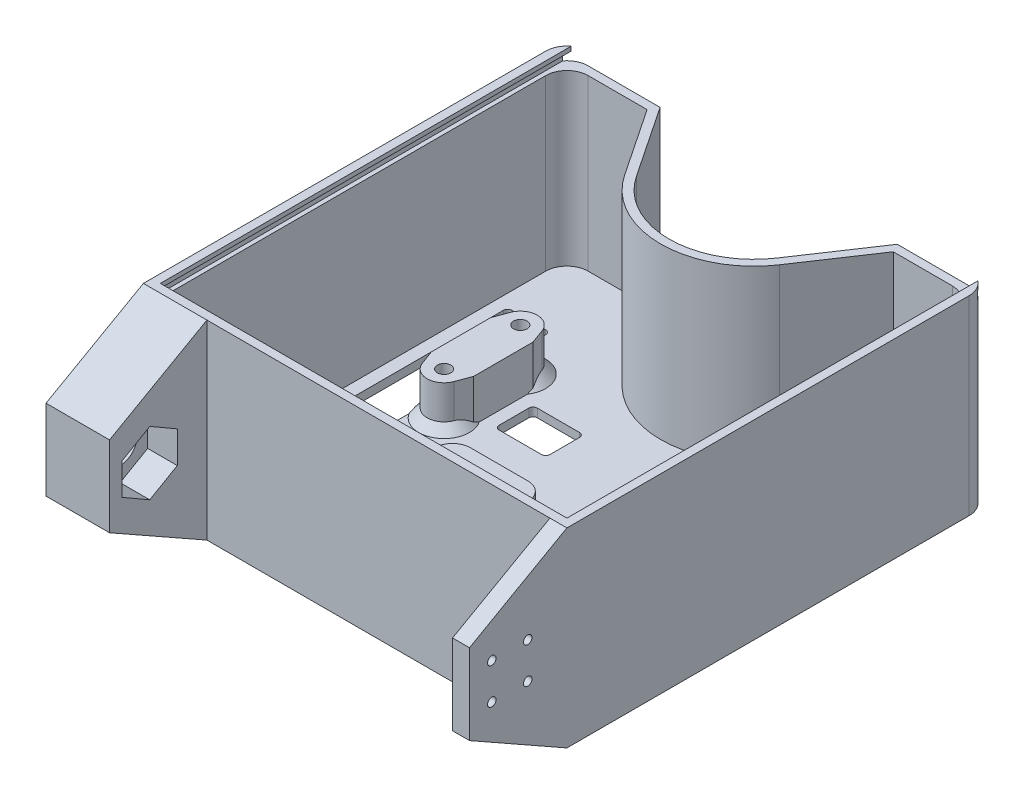
from build123d import *

# Parameters (mm, degrees)
AUFSATZ_LINEAR_AUSTRAGEN1_DEPTH  = 45
WANDUNG1_T                       = -2
SKIZZE1_W                        = 10
SKIZZE1_H                        = 42
SCHNITT_LINEAR_AUSTRAGEN1_DEPTH  = 2
SKIZZE2_R                        = 1.6
AUFSATZ_LINEAR_AUSTRAGEN2_DEPTH  = 10
VERRUNDUNG1_R                    = 1
SKIZZE6_R                        = 1.6
SCHNITT_LINEAR_AUSTRAGEN2_DEPTH  = 79.0320447
SCHNITT_LINEAR_AUSTRAGEN3_DEPTH  = 9
FASE1_SIZE                       = 2
SKIZZE8_W                        = 12
SKIZZE8_H                        = 9
SCHNITT_LINEAR_AUSTRAGEN4_DEPTH  = 2
VERRUNDUNG2_R                    = 1
VERRUNDUNG3_R                    = 5
VERRUNDUNG4_R                    = 5
SCHNITT_LINEAR_AUSTRAGEN5_REACH  = 85.815
AUFSATZ_LINEAR_AUSTRAGEN3_DEPTH  = 12
AUFSATZ_LINEAR_AUSTRAGEN4_DEPTH  = 2
FASE2_SIZE                       = 2
SKIZZE13_R                       = 1.6
SCHNITT_LINEAR_AUSTRAGEN6_DEPTH  = 2
SKIZZE14_W                       = 15
SKIZZE14_H                       = 45
SKIZZE14_W_2                     = 4
AUFSATZ_LINEAR_AUSTRAGEN5_DEPTH  = 23
SKIZZE18_R                       = 1
SCHNITT_LINEAR_AUSTRAGEN8_DEPTH  = 4
SKIZZE19_R                       = 2.5
SCHNITT_LINEAR_AUSTRAGEN9_DEPTH  = 2.5
SKIZZE20_W                       = 5
SKIZZE20_H                       = 10
SCHNITT_LINEAR_AUSTRAGEN10_DEPTH = 2
SKIZZE21_R                       = 4
SCHNITT_LINEAR_AUSTRAGEN11_DEPTH = 15
SKIZZE23_R                       = 7.5
SCHNITT_LINEAR_AUSTRAGEN12_DEPTH = 1
SKIZZE24_R                       = 7.5
SCHNITT_LINEAR_AUSTRAGEN13_DEPTH = 4
SCHNITT_LINEAR_AUSTRAGEN13_DRAFT = -45
SCHNITT_LINEAR_AUSTRAGEN14_DEPTH = 7
SCHNITT_LINEAR_AUSTRAGEN15_REACH = 133.735
SKIZZE31_W                       = 96
SKIZZE31_H                       = 3
SCHNITT_LINEAR_AUSTRAGEN16_DEPTH = 30
SKIZZE32_W                       = 98
SKIZZE32_H                       = 2
SCHNITT_LINEAR_AUSTRAGEN17_DEPTH = 99
SCHNITT_LINEAR_AUSTRAGEN18_REACH = 133.735


# Some blends are built 0.0001 mm under size
with BuildPart() as part:
    # Grundplatte → Aufsatz-Linear austragen1 (new body)
    with BuildSketch(Plane(origin=(0, 0, 0), x_dir=(1, 0, 0), z_dir=(0, 1, 0))):
        with BuildLine():
            Line((-50, 50), (-50, -50))
            Line((-50, -50), (50, -50))
            Line((50, -50), (50, 50))
            Line((50, 50), (28, 50))
            Line((28, 50), (16.61985221, 33))
            ThreePointArc((16.61985221, 33), (0, 24.125669082), (-16.61985221, 33))
            Line((-16.61985221, 33), (-28, 50))
            Line((-28, 50), (-50, 50))
        make_face()
    extrude(amount=AUFSATZ_LINEAR_AUSTRAGEN1_DEPTH)

    # Wandung1
    wandung1_openings = [part.faces().sort_by_distance(p)[0] for p in [
        (0, 45, 4.219695438),
    ]]
    offset(amount=WANDUNG1_T, openings=wandung1_openings, kind=Kind.INTERSECTION)

    # Skizze1 → Schnitt-Linear austragen1 (cut)
    with BuildSketch(Plane(origin=(0, 2, 0), x_dir=(1, 0, 0), z_dir=(0, 1, 0))):
        with Locations((-40, 10)):
            Rectangle(SKIZZE1_W, SKIZZE1_H)
        with Locations((40, 10)):
            Rectangle(SKIZZE1_W, SKIZZE1_H)
    extrude(amount=-SCHNITT_LINEAR_AUSTRAGEN1_DEPTH, mode=Mode.SUBTRACT)

    # Skizze2 → Aufsatz-Linear austragen2 (add)
    # profile 1 of 2: a face of its own
    with BuildSketch(Plane(origin=(0, 2, 0), x_dir=(1, 0, 0), z_dir=(0, 1, 0))):
        with BuildLine():
            Line((-35, 16), (-35, 4))
            Line((-35, 4), (-35, 3))
            Line((-35, 3), (-33.753255524, -0.383138811))
            ThreePointArc((-33.753255524, -0.383138811), (-30, -3), (-26.246744476, -0.383138811))
            Line((-26.246744476, -0.383138811), (-25, 3))
            Line((-25, 3), (-25, 4))
            Line((-25, 4), (-25, 16))
            Line((-25, 16), (-25, 17))
            Line((-25, 17), (-26.246744476, 20.383138811))
            ThreePointArc((-26.246744476, 20.383138811), (-30, 23), (-33.753255524, 20.383138811))
            Line((-33.753255524, 20.383138811), (-35, 17))
            Line((-35, 17), (-35, 16))
        make_face()
        with Locations(Location((-30, 19, 0), (0, 0, 270))):
            Circle(SKIZZE2_R, mode=Mode.SUBTRACT)
        with Locations(Location((-30, 1, 0), (0, 0, 270))):
            Circle(SKIZZE2_R, mode=Mode.SUBTRACT)
    # profile 2 of 2: a face of its own
    with BuildSketch(Plane(origin=(0, 2, 0), x_dir=(1, 0, 0), z_dir=(0, 1, 0))):
        with BuildLine():
            Line((35, 16), (35, 17))
            Line((35, 17), (33.753255524, 20.383138811))
            ThreePointArc((33.753255524, 20.383138811), (30, 23), (26.246744476, 20.383138811))
            Line((26.246744476, 20.383138811), (25, 17))
            Line((25, 17), (25, 16))
            Line((25, 16), (25, 4))
            Line((25, 4), (25, 3))
            Line((25, 3), (26.246744476, -0.383138811))
            ThreePointArc((26.246744476, -0.383138811), (30, -3), (33.753255524, -0.383138811))
            Line((33.753255524, -0.383138811), (35, 3))
            Line((35, 3), (35, 4))
            Line((35, 4), (35, 16))
        make_face()
        with Locations(Location((30, 1, 0), (0, 0, 90))):
            Circle(SKIZZE2_R, mode=Mode.SUBTRACT)
        with Locations(Location((30, 19, 0), (0, 0, 90))):
            Circle(SKIZZE2_R, mode=Mode.SUBTRACT)
    extrude(amount=AUFSATZ_LINEAR_AUSTRAGEN2_DEPTH)

    # Verrundung1
    verrundung1_edges = [part.edges().sort_by_distance(p)[0] for p in [
        (-35, 1, -31),
        (-35, 1, 11),
        (-45, 1, 11),
        (-45, 1, -31),
        (45, 1, -31),
        (45, 1, 11),
        (35, 1, 11),
        (35, 1, -31),
    ]]
    fillet(verrundung1_edges, radius=VERRUNDUNG1_R)

    # Skizze6 → Schnitt-Linear austragen2 (cut, through all)
    with BuildSketch(Plane(origin=(0, 12, 0), x_dir=(1, 0, 0), z_dir=(0, 1, 0))):
        with Locations(Location((-30, 19, 0), (0, 0, 270))):
            Circle(SKIZZE6_R)
        with Locations(Location((-30, 1, 0), (0, 0, 270))):
            Circle(SKIZZE6_R)
        with Locations(Location((30, 19, 0), (0, 0, 90))):
            Circle(SKIZZE6_R)
        with Locations(Location((30, 1, 0), (0, 0, 90))):
            Circle(SKIZZE6_R)
    extrude(amount=-SCHNITT_LINEAR_AUSTRAGEN2_DEPTH, mode=Mode.SUBTRACT)

    # Skizze7 → Schnitt-Linear austragen3 (cut)
    with BuildSketch(Plane.XZ):
        Polygon((-26.709103466, -1), (-28.354551733, 1.85), (-31.645448267, 1.85), (-33.290896534, -1), (-31.645448267, -3.85), (-28.354551733, -3.85), align=None)
        Polygon((28.354551733, -21.85), (26.709103466, -19), (28.354551733, -16.15), (31.645448267, -16.15), (33.290896534, -19), (31.645448267, -21.85), align=None)
        Polygon((-26.709103466, -19), (-28.354551733, -16.15), (-31.645448267, -16.15), (-33.290896534, -19), (-31.645448267, -21.85), (-28.354551733, -21.85), align=None)
        Polygon((28.354551733, -3.85), (26.709103466, -1), (28.354551733, 1.85), (31.645448267, 1.85), (33.290896534, -1), (31.645448267, -3.85), align=None)
    extrude(amount=-SCHNITT_LINEAR_AUSTRAGEN3_DEPTH, mode=Mode.SUBTRACT)

    # Fase1
    # the kernel refuses this chamfer: 2 mm, written as the material it adds along each edge
    with BuildSketch(Plane(origin=(33.753255524, 2, 0.383138811), x_dir=(0.9379591204561566, -0.02749587661058633, 0.3456539673177909), z_dir=(0.3457847026662013, 0, -0.9383138810664834))) as fase1_piece_1_section:
        Polygon((FASE1_SIZE * 0.999621916911, -FASE1_SIZE * 0.0274958766106), (-FASE1_SIZE * 0.0274958766106, -FASE1_SIZE * 0.999621916911), (0, 0), align=None)
    fase1_piece_1 = extrude(amount=8.748917251, mode=Mode.PRIVATE)
    fase1_piece_1 = split(fase1_piece_1, bisect_by=Plane(origin=(35, 2.810043693, -0.69339811), z_dir=(-1, 0, 0)), keep=Keep.TOP, mode=Mode.PRIVATE)
    add(fase1_piece_1)
    with BuildSketch(Plane(origin=(30, 2, -1), x_dir=(-0.5946157089023157, 0, -0.8040100488965276), z_dir=(0.8040100488965276, 0, -0.5946157089023157))) as fase1_piece_2_section:
        Polygon((4 + FASE1_SIZE, 0), (4, FASE1_SIZE), (4, 0), align=None)
    fase1_piece_2 = revolve(axis=Axis((30, 2, -1), (0, 1, 0)), revolution_arc=213.285054007, mode=Mode.PRIVATE)
    fase1_piece_2 = split(fase1_piece_2, bisect_by=Plane(origin=(35, 2.618842305, 0.921149391), z_dir=(-1, 0, 0)), keep=Keep.TOP, mode=Mode.PRIVATE)
    add(fase1_piece_2)
    with BuildSketch(Plane(origin=(36.778497275, 2, -12.173908309), x_dir=(0.937959120456157, -0.027495876610586348, -0.34565396731779), z_dir=(-0.34578470266620037, 0, -0.9383138810664838))) as fase1_piece_3_section:
        Polygon((FASE1_SIZE * 0.999621916911, -FASE1_SIZE * 0.0274958766106), (-FASE1_SIZE * 0.0274958766106, -FASE1_SIZE * 0.999621916911), (0, 0), align=None)
    fase1_piece_3 = extrude(amount=8.748917251, mode=Mode.PRIVATE)
    fase1_piece_3 = split(fase1_piece_3, bisect_by=Plane(origin=(35, 2.810043693, -19.30660189), z_dir=(-1, 0, 0)), keep=Keep.TOP, mode=Mode.PRIVATE)
    add(fase1_piece_3)
    with BuildSketch(Plane(origin=(30, 2, -19), x_dir=(0.9383138810664835, 0, -0.3457847026662016), z_dir=(0.3457847026662016, 0, 0.9383138810664835))) as fase1_piece_4_section:
        Polygon((4 + FASE1_SIZE, 0), (4, FASE1_SIZE), (4, 0), align=None)
    fase1_piece_4 = revolve(axis=Axis((30, 2, -19), (0, 1, 0)), revolution_arc=213.285054007, mode=Mode.PRIVATE)
    fase1_piece_4 = split(fase1_piece_4, bisect_by=Plane(origin=(35, 2.568302244, -21.912371656), z_dir=(-1, 0, 0)), keep=Keep.TOP, mode=Mode.PRIVATE)
    add(fase1_piece_4)
    with BuildSketch(Plane(origin=(-33.753255524, 2, -20.383138811), x_dir=(-0.9379591204561563, -0.02749587661058632, -0.34565396731779174), z_dir=(-0.34578470266620215, 0, 0.9383138810664832))) as fase1_piece_5_section:
        Polygon((FASE1_SIZE * 0.999621916911, -FASE1_SIZE * 0.0274958766106), (-FASE1_SIZE * 0.0274958766106, -FASE1_SIZE * 0.999621916911), (0, 0), align=None)
    fase1_piece_5 = extrude(amount=8.748917251, mode=Mode.PRIVATE)
    fase1_piece_5 = split(fase1_piece_5, bisect_by=Plane(origin=(-35, 2.810043693, -19.30660189), z_dir=(1, 0, 0)), keep=Keep.TOP, mode=Mode.PRIVATE)
    add(fase1_piece_5)
    with BuildSketch(Plane(origin=(-30, 2, -19), x_dir=(0.5946157089023089, 0, 0.8040100488965327), z_dir=(-0.8040100488965327, 0, 0.5946157089023089))) as fase1_piece_6_section:
        Polygon((4 + FASE1_SIZE, 0), (4, FASE1_SIZE), (4, 0), align=None)
    fase1_piece_6 = revolve(axis=Axis((-30, 2, -19), (0, 1, 0)), revolution_arc=213.285054007, mode=Mode.PRIVATE)
    fase1_piece_6 = split(fase1_piece_6, bisect_by=Plane(origin=(-35, 2.618842305, -20.921149391), z_dir=(1, 0, 0)), keep=Keep.TOP, mode=Mode.PRIVATE)
    add(fase1_piece_6)
    with BuildSketch(Plane(origin=(-36.778497275, 2, -7.826091691), x_dir=(-0.937959120456156, -0.02749587661058632, 0.3456539673177927), z_dir=(0.3457847026662031, 0, 0.9383138810664828))) as fase1_piece_7_section:
        Polygon((FASE1_SIZE * 0.999621916911, -FASE1_SIZE * 0.0274958766106), (-FASE1_SIZE * 0.0274958766106, -FASE1_SIZE * 0.999621916911), (0, 0), align=None)
    fase1_piece_7 = extrude(amount=8.748917251, mode=Mode.PRIVATE)
    fase1_piece_7 = split(fase1_piece_7, bisect_by=Plane(origin=(-35, 2.810043693, -0.69339811), z_dir=(1, 0, 0)), keep=Keep.TOP, mode=Mode.PRIVATE)
    add(fase1_piece_7)
    with BuildSketch(Plane(origin=(-30, 2, -1), x_dir=(-0.9383138810664808, 0, 0.34578470266620803), z_dir=(-0.34578470266620803, 0, -0.9383138810664808))) as fase1_piece_8_section:
        Polygon((4 + FASE1_SIZE, 0), (4, FASE1_SIZE), (4, 0), align=None)
    fase1_piece_8 = revolve(axis=Axis((-30, 2, -1), (0, 1, 0)), revolution_arc=213.285054007, mode=Mode.PRIVATE)
    fase1_piece_8 = split(fase1_piece_8, bisect_by=Plane(origin=(-35, 2.568302244, 1.912371656), z_dir=(1, 0, 0)), keep=Keep.TOP, mode=Mode.PRIVATE)
    add(fase1_piece_8)

    # Skizze8 → Schnitt-Linear austragen4 (cut)
    with BuildSketch(Plane.XZ):
        with Locations((16, -9.5)):
            Rectangle(SKIZZE8_W, SKIZZE8_H)
        with Locations((-16, -9.5)):
            Rectangle(SKIZZE8_W, SKIZZE8_H)
    extrude(amount=-SCHNITT_LINEAR_AUSTRAGEN4_DEPTH, mode=Mode.SUBTRACT)

    # Verrundung2
    verrundung2_edges = [part.edges().sort_by_distance(p)[0] for p in [
        (-10, 1, -14),
        (-10, 1, -5),
        (-22, 1, -5),
        (-22, 1, -14),
        (10, 1, -5),
        (10, 1, -14),
        (22, 1, -14),
        (22, 1, -5),
    ]]
    fillet(verrundung2_edges, radius=VERRUNDUNG2_R)

    # Verrundung3
    verrundung3_edges = [part.edges().sort_by_distance(p)[0] for p in [
        (-50, 22.5, -50),
        (50, 22.5, -50),
    ]]
    fillet(verrundung3_edges, radius=VERRUNDUNG3_R)

    # Verrundung4
    verrundung4_edges = [part.edges().sort_by_distance(p)[0] for p in [
        (48, 23.5, -48),
        (-48, 23.5, -48),
    ]]
    fillet(verrundung4_edges, radius=VERRUNDUNG4_R)

    # Skizze9 → Schnitt-Linear austragen5 (cut, up to next)
    with BuildSketch(Plane.XZ, mode=Mode.PRIVATE) as schnitt_linear_austragen5_sk1:
        with BuildLine():
            Line((-6.8, 43), (6.8, 43))
            ThreePointArc((6.8, 43), (7.648528137, 42.648528137), (8, 41.8))
            Line((8, 41.8), (8, 20.2))
            ThreePointArc((8, 20.2), (7.648528137, 19.351471863), (6.8, 19))
            Line((6.8, 19), (-6.8, 19))
            ThreePointArc((-6.8, 19), (-7.648528137, 19.351471863), (-8, 20.2))
            Line((-8, 20.2), (-8, 41.8))
            ThreePointArc((-8, 41.8), (-7.648528137, 42.648528137), (-6.8, 43))
        make_face()
    schnitt_linear_austragen5_tool1 = extrude(schnitt_linear_austragen5_sk1.sketch, amount=-SCHNITT_LINEAR_AUSTRAGEN5_REACH, mode=Mode.PRIVATE) & part.part
    add(schnitt_linear_austragen5_tool1.solids().sort_by_distance((0, 0, 31))[0], mode=Mode.SUBTRACT)

    # Skizze11 → Aufsatz-Linear austragen3 (add)
    with BuildSketch(Plane(origin=(0, 2, 0), x_dir=(1, 0, 0), z_dir=(0, 1, 0))):
        with BuildLine():
            Line((-6.8, -46), (6.8, -46))
            ThreePointArc((6.8, -46), (9.769848481, -44.769848481), (11, -41.8))
            Line((11, -41.8), (11, -20.2))
            ThreePointArc((11, -20.2), (9.769848481, -17.230151519), (6.8, -16))
            Line((6.8, -16), (-6.8, -16))
            ThreePointArc((-6.8, -16), (-9.769848481, -17.230151519), (-11, -20.2))
            Line((-11, -20.2), (-11, -41.8))
            ThreePointArc((-11, -41.8), (-9.769848481, -44.769848481), (-6.8, -46))
        make_face()
        with BuildLine():
            Line((-8, -20.2), (-8, -41.8))
            ThreePointArc((-8, -41.8), (-7.648528137, -42.648528137), (-6.8, -43))
            Line((-6.8, -43), (6.8, -43))
            ThreePointArc((6.8, -43), (7.648528137, -42.648528137), (8, -41.8))
            Line((8, -41.8), (8, -20.2))
            ThreePointArc((8, -20.2), (7.648528137, -19.351471863), (6.8, -19))
            Line((6.8, -19), (-6.8, -19))
            ThreePointArc((-6.8, -19), (-7.648528137, -19.351471863), (-8, -20.2))
        make_face(mode=Mode.SUBTRACT)
    extrude(amount=AUFSATZ_LINEAR_AUSTRAGEN3_DEPTH)

    # Skizze12 → Aufsatz-Linear austragen4 (add)
    with BuildSketch(Plane(origin=(0, 14, 0), x_dir=(1, 0, 0), z_dir=(0, 1, 0))):
        with BuildLine():
            Line((11, -41.8), (11, -20.2))
            ThreePointArc((11, -20.2), (9.769848481, -17.230151519), (6.8, -16))
            Line((6.8, -16), (-6.8, -16))
            ThreePointArc((-6.8, -16), (-9.769848481, -17.230151519), (-11, -20.2))
            Line((-11, -20.2), (-11, -41.8))
            ThreePointArc((-11, -41.8), (-9.769848481, -44.769848481), (-6.8, -46))
            Line((-6.8, -46), (6.8, -46))
            ThreePointArc((6.8, -46), (9.769848481, -44.769848481), (11, -41.8))
        make_face()
    extrude(amount=AUFSATZ_LINEAR_AUSTRAGEN4_DEPTH)

    # Fase2
    fase2_edges = [part.edges().sort_by_distance(p)[0] for p in [
        (9.769848481, 2, 44.769848481),
        (11, 2, 31),
        (9.769848481, 2, 17.230151519),
        (0, 2, 16),
        (-9.769848481, 2, 17.230151519),
        (-11, 2, 31),
        (-9.769848481, 2, 44.769848481),
        (0, 2, 46),
    ]]
    chamfer(fase2_edges, length=FASE2_SIZE - 0.0001)  # a hair under: the kernel refuses the full size

    # Skizze13 → Schnitt-Linear austragen6 (cut)
    with BuildSketch(Plane(origin=(0, 16, 0), x_dir=(1, 0, 0), z_dir=(0, 1, 0))):
        with Locations(Location((0, -23, 0), (0, 0, 270))):
            Circle(SKIZZE13_R)
        with Locations(Location((0, -39, 0), (0, 0, 270))):
            Circle(SKIZZE13_R)
    extrude(amount=-SCHNITT_LINEAR_AUSTRAGEN6_DEPTH, mode=Mode.SUBTRACT)

    # Skizze14 → Aufsatz-Linear austragen5 (add)
    with BuildSketch(Plane.XY.offset(50)):
        with Locations((-42.5, 22.5)):
            Rectangle(SKIZZE14_W, SKIZZE14_H)
        with Locations((48, 22.5)):
            Rectangle(SKIZZE14_W_2, SKIZZE14_H)
    extrude(amount=AUFSATZ_LINEAR_AUSTRAGEN5_DEPTH)

    # Skizze18 → Schnitt-Linear austragen8 (cut)
    with BuildSketch(Plane(origin=(50, 0, 0), x_dir=(0, 0, -1), z_dir=(1, 0, 0))):
        with Locations((-59.257359313, 18.257359313)):
            Circle(SKIZZE18_R)
        with Locations((-67.742640687, 18.257359313)):
            Circle(SKIZZE18_R)
        with Locations((-67.742640687, 26.742640687)):
            Circle(SKIZZE18_R)
        with Locations((-59.257359313, 26.742640687)):
            Circle(SKIZZE18_R)
    extrude(amount=-SCHNITT_LINEAR_AUSTRAGEN8_DEPTH, mode=Mode.SUBTRACT)

    # Skizze19 → Schnitt-Linear austragen9 (cut)
    with BuildSketch(Plane.ZY.offset(-46)):
        with Locations(Location((63.5, 22.5, 0), (0, 0, 270))):
            Circle(SKIZZE19_R)
    extrude(amount=-SCHNITT_LINEAR_AUSTRAGEN9_DEPTH, mode=Mode.SUBTRACT)

    # Skizze20 → Schnitt-Linear austragen10 (cut)
    with BuildSketch(Plane.XY.offset(50)):
        with Locations((43.5, 22.5)):
            Rectangle(SKIZZE20_W, SKIZZE20_H)
    extrude(amount=-SCHNITT_LINEAR_AUSTRAGEN10_DEPTH, mode=Mode.SUBTRACT)

    # Skizze21 → Schnitt-Linear austragen11 (cut)
    with BuildSketch(Plane.ZY.offset(50)):
        with Locations((63.5, 22.5)):
            Circle(SKIZZE21_R)
    extrude(amount=-SCHNITT_LINEAR_AUSTRAGEN11_DEPTH, mode=Mode.SUBTRACT)

    # Skizze23 → Schnitt-Linear austragen12 (cut)
    with BuildSketch(Plane.ZY.offset(50)):
        with Locations((63.5, 22.5)):
            Circle(SKIZZE23_R)
    extrude(amount=-SCHNITT_LINEAR_AUSTRAGEN12_DEPTH, mode=Mode.SUBTRACT)


with BuildPart() as schnitt_linear_austragen13_tool:
    # Skizze24 → Schnitt-Linear austragen13 (with draft: the straight prism first)
    with BuildSketch(Plane.ZY.offset(49)):
        with Locations((63.5, 22.5)):
            Circle(SKIZZE24_R)
    extrude(amount=-SCHNITT_LINEAR_AUSTRAGEN13_DEPTH)
    # Schnitt-Linear austragen13: the draft: its side faces are tilted about the plane it starts from
    schnitt_linear_austragen13_sides = [schnitt_linear_austragen13_tool.faces().sort_by_distance(p)[0] for p in [
        (-47, 22.5, 56),
    ]]
    draft(schnitt_linear_austragen13_sides, Plane.ZY.offset(49), SCHNITT_LINEAR_AUSTRAGEN13_DRAFT)


with BuildPart() as part_1:
    add(part.part)

    # Schnitt-Linear austragen13: cut by schnitt_linear_austragen13_tool
    add(schnitt_linear_austragen13_tool.part, mode=Mode.SUBTRACT)

    # Skizze26 → Schnitt-Linear austragen14 (cut)
    with BuildSketch(Plane(origin=(-35, 0, 0), x_dir=(0, 0, -1), z_dir=(1, 0, 0))):
        Polygon((-57, 18.74722325), (-57, 26.25277675), (-63.5, 30.005553499), (-70, 26.25277675), (-70, 18.74722325), (-63.5, 14.994446501), align=None)
    extrude(amount=-SCHNITT_LINEAR_AUSTRAGEN14_DEPTH, mode=Mode.SUBTRACT)

    # Schnitt-Linear austragen15: up to this face of the body (flat: up to its plane)
    schnitt_linear_austragen15_end = Plane(part_1.part.faces().sort_by_distance((50, 22.5, 13.882577982))[0])
    # Skizze29 → Schnitt-Linear austragen15 (cut, up to the picked face)
    with BuildSketch(Plane.ZY.offset(50), mode=Mode.PRIVATE) as schnitt_linear_austragen15_sk1:
        Polygon((73, 45), (73, 32), (50, 45), align=None)
    schnitt_linear_austragen15_tool1 = split(extrude(schnitt_linear_austragen15_sk1.sketch, amount=-SCHNITT_LINEAR_AUSTRAGEN15_REACH, mode=Mode.PRIVATE), bisect_by=schnitt_linear_austragen15_end, keep=Keep.BOTH, mode=Mode.PRIVATE)
    add(schnitt_linear_austragen15_tool1.solids().sort_by(Axis((-50, 40.666667, 65.333333), (1, 0, 0)))[0], mode=Mode.SUBTRACT)

    # Skizze31 → Schnitt-Linear austragen16 (cut)
    with BuildSketch(Plane(origin=(0, 0, -50), x_dir=(-1, 0, 0), z_dir=(0, 0, -1))):
        with Locations((0, 43.5)):
            Rectangle(SKIZZE31_W, SKIZZE31_H)
    extrude(amount=-SCHNITT_LINEAR_AUSTRAGEN16_DEPTH, mode=Mode.SUBTRACT)

    # Skizze32 → Schnitt-Linear austragen17 (cut)
    with BuildSketch(Plane(origin=(0, 0, -50), x_dir=(-1, 0, 0), z_dir=(0, 0, -1))):
        with Locations((0, 43)):
            Rectangle(SKIZZE32_W, SKIZZE32_H)
    extrude(amount=-SCHNITT_LINEAR_AUSTRAGEN17_DEPTH, mode=Mode.SUBTRACT)

    # Schnitt-Linear austragen18: up to this face of the body (flat: up to its plane)
    schnitt_linear_austragen18_end = Plane(part_1.part.faces().sort_by_distance((-50, 21.955049437, 10.704973426))[0])
    # Skizze33 → Schnitt-Linear austragen18 (cut, up to the picked face)
    with BuildSketch(Plane(origin=(50, 0, 0), x_dir=(0, 0, -1), z_dir=(1, 0, 0)), mode=Mode.PRIVATE) as schnitt_linear_austragen18_sk1:
        Polygon((-50, 0), (-73, 13), (-73, 0), align=None)
    schnitt_linear_austragen18_tool1 = split(extrude(schnitt_linear_austragen18_sk1.sketch, amount=-SCHNITT_LINEAR_AUSTRAGEN18_REACH, mode=Mode.PRIVATE), bisect_by=schnitt_linear_austragen18_end, keep=Keep.BOTH, mode=Mode.PRIVATE)
    add(schnitt_linear_austragen18_tool1.solids().sort_by(Axis((50, 4.333333, 65.333333), (-1, 0, 0)))[0], mode=Mode.SUBTRACT)


solid = part_1.part
